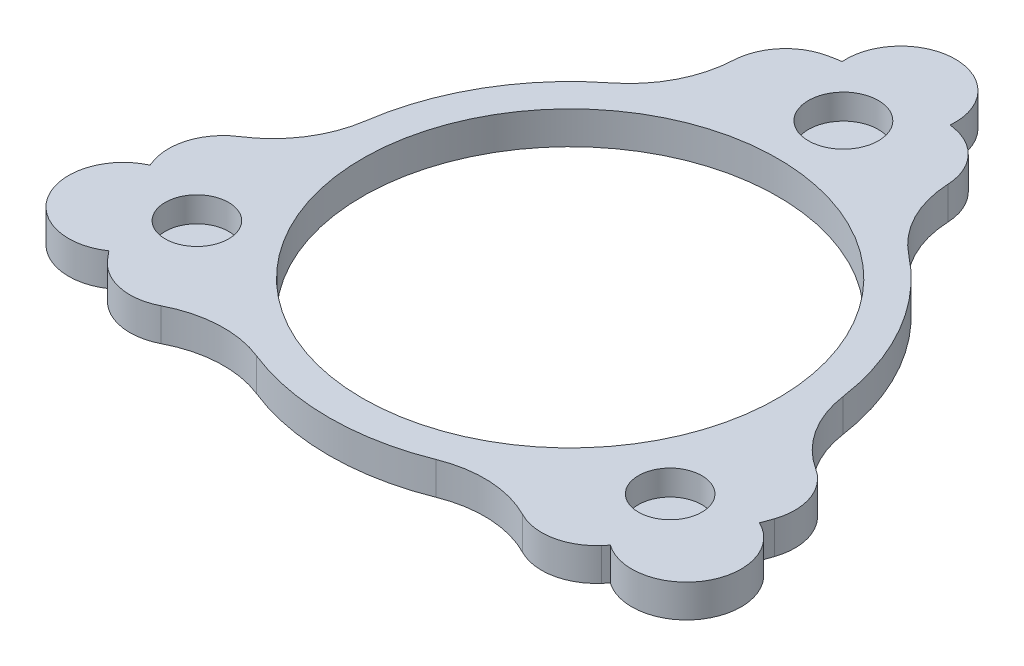
from build123d import *

# Parameters (mm, degrees)
SKETCH1_R                = 19
BOSS_EXTRUDE1_DEPTH      = 3.5
SKETCH2_R                = 30
SKETCH2_R_2              = 19
SKETCH2_R_3              = 2.8
BOSS_EXTRUDE2_DEPTH      = 3
BOSS_EXTRUDE3_DEPTH      = 2
BOSS_EXTRUDE3_DEPTH_BACK = 3
SKETCH4_R                = 2.9
SKETCH5_R                = 5
BOSS_EXTRUDE4_DEPTH      = 3
CUT_EXTRUDE1_START       = -10
SKETCH3_R                = 19
CUT_EXTRUDE1_DEPTH       = 10
SKETCH6_R                = 3.2
SKETCH6_R_2              = 2.9
CUT_EXTRUDE2_DEPTH       = 2.3
CUT_EXTRUDE3_START       = -13
CUT_EXTRUDE3_DEPTH       = 13
FILLET1_R                = 10
FILLET2_R                = 5


with BuildPart() as part:
    # Sketch1 → Boss-Extrude1 (new body)
    with BuildSketch(Plane(origin=(0, 0, 0), x_dir=(1, 0, 0), z_dir=(0, 1, 0))):
        with Locations(Location((0, 0, 0), (0, 0, 270))):
            Circle(SKETCH1_R)
    extrude(amount=BOSS_EXTRUDE1_DEPTH)

    # Sketch2 → Boss-Extrude2 (add)
    with BuildSketch(Plane(origin=(0, 0, 0), x_dir=(1, 0, 0), z_dir=(0, 1, 0))):
        with Locations(Location((0, 0, 0), (0, 0, 270))):
            Circle(SKETCH2_R)
        with Locations(Location((0, 0, 0), (0, 0, 270))):
            Circle(SKETCH2_R_2, mode=Mode.SUBTRACT)
        with Locations(Location((0, 25, 0), (0, 0, 270))):
            Circle(SKETCH2_R_3, mode=Mode.SUBTRACT)
        with Locations(Location((21.650635095, -12.5, 0), (0, 0, 270))):
            Circle(SKETCH2_R_3, mode=Mode.SUBTRACT)
        with Locations(Location((-21.650635095, -12.5, 0), (0, 0, 270))):
            Circle(SKETCH2_R_3, mode=Mode.SUBTRACT)
    extrude(amount=BOSS_EXTRUDE2_DEPTH)

    # Sketch4 → Boss-Extrude3 (add, two sides: drawn at the far end of the back side and taken through both)
    with BuildSketch(Plane.XZ.offset(-BOSS_EXTRUDE3_DEPTH_BACK)):
        with Locations(Location((-21.650635095, 12.5, 0), (0, 0, 270))):
            Circle(SKETCH4_R)
        with Locations(Location((21.650635095, 12.5, 0), (0, 0, 270))):
            Circle(SKETCH4_R)
        with Locations(Location((0, -25, 0), (0, 0, 270))):
            Circle(SKETCH4_R)
    extrude(amount=BOSS_EXTRUDE3_DEPTH + BOSS_EXTRUDE3_DEPTH_BACK)

    # Sketch5 → Boss-Extrude4 (add)
    with BuildSketch(Plane(origin=(0, 3, 0), x_dir=(1, 0, 0), z_dir=(0, 1, 0))):
        with Locations((-26.103110985, -14.7860609)):
            Circle(SKETCH5_R)
        with Locations((0.246451131, 29.99898768)):
            Circle(SKETCH5_R)
        with Locations((25.856659853, -15.212926781)):
            Circle(SKETCH5_R)
    extrude(amount=-BOSS_EXTRUDE4_DEPTH)

    # Sketch3 → Cut-Extrude1 (cut)
    with BuildSketch(Plane(origin=(0, 3.5, 0), x_dir=(1, 0, 0), z_dir=(0, 1, 0)).offset(CUT_EXTRUDE1_START)):
        with Locations(Location((0, 0, 0), (0, 0, 270))):
            Circle(SKETCH3_R)
    extrude(amount=CUT_EXTRUDE1_DEPTH, mode=Mode.SUBTRACT)

    # Sketch6 → Cut-Extrude2 (cut)
    with BuildSketch(Plane(origin=(0, 3, 0), x_dir=(1, 0, 0), z_dir=(0, 1, 0))):
        with Locations(Location((0, 25, 0), (0, 0, 270))):
            Circle(SKETCH6_R)
        with Locations(Location((21.650635095, -12.5, 0), (0, 0, 90))):
            Circle(SKETCH6_R_2)
        with Locations(Location((-21.650635095, -12.5, 0), (0, 0, 90))):
            Circle(SKETCH6_R_2)
    extrude(amount=-CUT_EXTRUDE2_DEPTH, mode=Mode.SUBTRACT)

    # Sketch7 → Cut-Extrude3 (cut)
    with BuildSketch(Plane(origin=(0, 3, 0), x_dir=(1, 0, 0), z_dir=(0, 1, 0)).offset(CUT_EXTRUDE3_START)):
        with BuildLine():
            ThreePointArc((-29.54423259, -5.20944533), (-25.980762114, 15), (-10.2606043, 28.190778624))
            Line((-10.2606043, 28.190778624), (-13.773984089, 37.84371026))
            Line((-13.773984089, 37.84371026), (-43.939319858, -7.747687605))
            Line((-43.939319858, -7.747687605), (-29.54423259, -5.20944533))
        make_face()
        with BuildLine():
            ThreePointArc((-21.729408673, -3.831481024), (-19.108521295, 11.032309914), (-7.546544436, 20.733960432))
            Line((-7.546544436, 20.733960432), (-10.2606043, 28.190778624))
            ThreePointArc((-10.2606043, 28.190778624), (-25.980762114, 15), (-29.54423259, -5.20944533))
            Line((-29.54423259, -5.20944533), (-21.729408673, -3.831481024))
        make_face()
        with BuildLine():
            Line((15.259965643, 41.926411025), (10.2606043, 28.190778624))
            ThreePointArc((10.2606043, 28.190778624), (25.980762114, 15), (29.54423259, -5.20944533))
            Line((29.54423259, -5.20944533), (39.660606503, -6.993234998))
            Line((39.660606503, -6.993234998), (15.259965643, 41.926411025))
        make_face()
        with BuildLine():
            Line((10.2606043, 28.190778624), (7.546544436, 20.733960432))
            ThreePointArc((7.546544436, 20.733960432), (18.074278438, 12.65574601), (22.064619828, 0))
            ThreePointArc((22.064619828, 0), (21.980657288, -1.92305833), (21.729408673, -3.831481024))
            Line((21.729408673, -3.831481024), (29.54423259, -5.20944533))
            ThreePointArc((29.54423259, -5.20944533), (25.980762114, 15), (10.2606043, 28.190778624))
        make_face()
        with BuildLine():
            Line((28.679354216, -34.17872342), (19.283628291, -22.981333294))
            ThreePointArc((19.283628291, -22.981333294), (0, -30), (-19.283628291, -22.981333294))
            Line((-19.283628291, -22.981333294), (-25.886622414, -30.850475262))
            Line((-25.886622414, -30.850475262), (28.679354216, -34.17872342))
        make_face()
        with BuildLine():
            Line((19.283628291, -22.981333294), (14.182864238, -16.902479408))
            ThreePointArc((14.182864238, -16.902479408), (0, -22.064619828), (-14.182864238, -16.902479408))
            Line((-14.182864238, -16.902479408), (-19.283628291, -22.981333294))
            ThreePointArc((-19.283628291, -22.981333294), (0, -30), (19.283628291, -22.981333294))
        make_face()
    extrude(amount=CUT_EXTRUDE3_DEPTH, mode=Mode.SUBTRACT)

    # Fillet1
    # the kernel refuses this fillet: 10 mm, written as the material it adds along each edge
    with BuildSketch(Plane(origin=(-21.729408673, 0, 3.831481024), x_dir=(-0.9848077530122133, 0, 0.17364817766690055), z_dir=(0, 1, 0)), Plane(origin=(14.182864238, 0, 16.902479408), x_dir=(0.6427876096865253, 0, 0.7660444431189899), z_dir=(0, 1, 0)), Plane(origin=(7.546544436, 0, -20.733960432), x_dir=(0.34202014332569675, 0, -0.9396926207858982), z_dir=(0, 1, 0))) as fillet1_piece_1:
        with BuildLine():
            CenterArc((8.404377584, -9.988996017), FILLET1_R, 92.688143309, 69.160575724)
            Line((-1.097995304, -6.873725644), (-1.288042762, -6.811420237))
            ThreePointArc((-1.288042762, -6.811420237), (-0.473724072, -3.448886874), (-0.2, 0))
            Line((-0.2, 0), (0, 0.2))
            ThreePointArc((0, 0.2), (3.967690086, 0.2), (7.926000224, 0.19977992))
            Line((7.926000224, 0.19977992), (7.935380172, 0))
        make_face()
    extrude(amount=3)
    with BuildSketch(Plane(origin=(-14.182864238, 0, 16.902479408), x_dir=(0.8578464941811706, 0, 0.5139060151633514), z_dir=(0, 1, 0)), Plane(origin=(21.729408673, 0, 3.831481024), x_dir=(0.01613241719851076, 0, -0.9998698640899891), z_dir=(0, 1, 0)), Plane(origin=(-7.546544436, 0, -20.733960432), x_dir=(-0.8739789113796794, 0, 0.48596384892663586), z_dir=(0, 1, 0))) as fillet1_piece_2:
        with BuildLine():
            CenterArc((8.538251552, -9.87480959), FILLET1_R, 99.075640483, 69.160575724)
            Line((-1.251712984, -7.836036823), (-1.447512274, -7.795261367))
            ThreePointArc((-1.447512274, -7.795261367), (-0.823352684, -3.886470761), (-0.197496192, 0.03154765))
            Line((-0.197496192, 0.03154765), (0.03154765, 0.197496192))
            ThreePointArc((0.03154765, 0.197496192), (3.480434524, -0.07622788), (6.929321399, 0.197496192))
            Line((6.929321399, 0.197496192), (6.960869049, 0))
        make_face()
    extrude(amount=3)

    # Fillet2
    fillet2_edges = [part.edges().sort_by_distance(p)[0] for p in [
        (-19.283628291, 1.5, 22.981333294),
        (19.283628291, 1.5, 22.981333294),
        (29.54423259, 1.5, 5.20944533),
        (10.2606043, 1.5, -28.190778624),
        (-10.2606043, 1.5, -28.190778624),
        (-29.54423259, 1.5, 5.20944533),
    ]]
    fillet(fillet2_edges, radius=FILLET2_R)


solid = part.part
